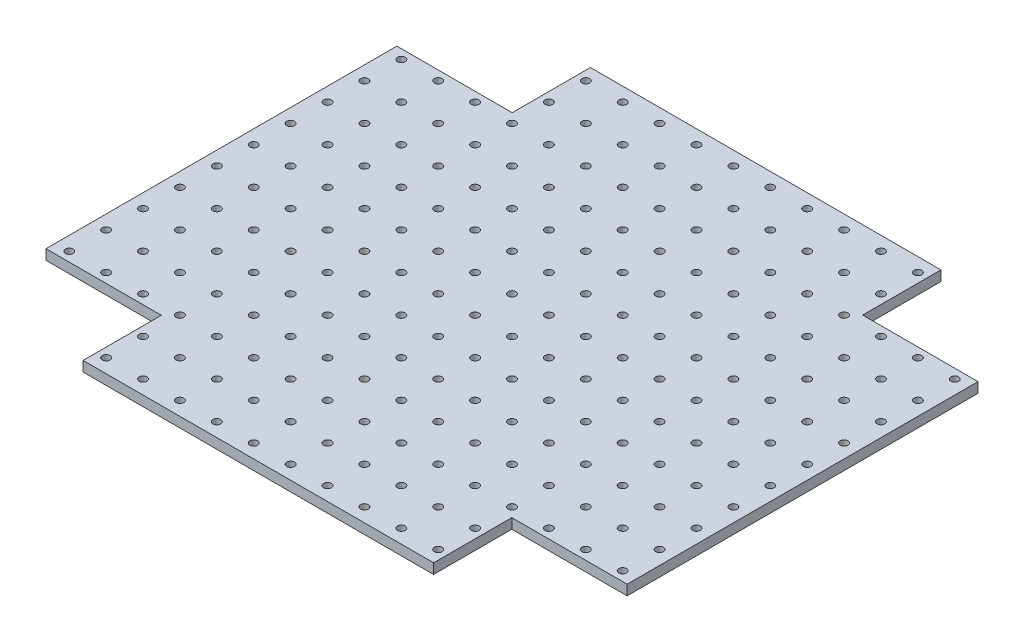
from build123d import *

# Parameters (mm, degrees)
BOSS_EXTRUDE1_DEPTH = 5.4864
SKETCH2_R           = 2.1
CUT_EXTRUDE1_DEPTH  = 210.1473179


with BuildPart() as part:
    # Sketch1 → Boss-Extrude1 (new body)
    with BuildSketch(Plane(origin=(0, 0, 0), x_dir=(1, 0, 0), z_dir=(0, 1, 0))):
        Polygon((95, -95.1), (157.5, -95.1), (157.5, 95.1), (95, 95.1), (95, 137.5), (-95, 137.5), (-95, 95.1), (-157.5, 95.1), (-157.5, -95.1), (-95, -95.1), (-95, -137.5), (95, -137.5), align=None)
    extrude(amount=BOSS_EXTRUDE1_DEPTH)

    # Sketch2 → Cut-Extrude1 (cut, through all)
    with BuildSketch(Plane(origin=(0, 5.4864, 0), x_dir=(1, 0, 0), z_dir=(0, 1, 0))):
        with Locations((90, -130)):
            Circle(SKETCH2_R)
        with Locations((70, -130)):
            Circle(SKETCH2_R)
        with Locations((50, -130)):
            Circle(SKETCH2_R)
        with Locations((30, -130)):
            Circle(SKETCH2_R)
        with Locations((10, -130)):
            Circle(SKETCH2_R)
        with Locations((-10, -130)):
            Circle(SKETCH2_R)
        with Locations((-30, -130)):
            Circle(SKETCH2_R)
        with Locations((-50, -130)):
            Circle(SKETCH2_R)
        with Locations((-70, -130)):
            Circle(SKETCH2_R)
        with Locations((-90, -130)):
            Circle(SKETCH2_R)
        with Locations((-110, -130)):
            Circle(SKETCH2_R)
        with Locations((90, -110)):
            Circle(SKETCH2_R)
        with Locations((70, -110)):
            Circle(SKETCH2_R)
        with Locations((50, -110)):
            Circle(SKETCH2_R)
        with Locations((30, -110)):
            Circle(SKETCH2_R)
        with Locations((10, -110)):
            Circle(SKETCH2_R)
        with Locations((-10, -110)):
            Circle(SKETCH2_R)
        with Locations((-30, -110)):
            Circle(SKETCH2_R)
        with Locations((-50, -110)):
            Circle(SKETCH2_R)
        with Locations((-70, -110)):
            Circle(SKETCH2_R)
        with Locations((-90, -110)):
            Circle(SKETCH2_R)
        with Locations((-110, -110)):
            Circle(SKETCH2_R)
        with Locations((150, -90)):
            Circle(SKETCH2_R)
        with Locations((130, -90)):
            Circle(SKETCH2_R)
        with Locations((110, -90)):
            Circle(SKETCH2_R)
        with Locations((90, -90)):
            Circle(SKETCH2_R)
        with Locations((70, -90)):
            Circle(SKETCH2_R)
        with Locations((50, -90)):
            Circle(SKETCH2_R)
        with Locations((30, -90)):
            Circle(SKETCH2_R)
        with Locations((10, -90)):
            Circle(SKETCH2_R)
        with Locations((-10, -90)):
            Circle(SKETCH2_R)
        with Locations((-30, -90)):
            Circle(SKETCH2_R)
        with Locations((-50, -90)):
            Circle(SKETCH2_R)
        with Locations((-70, -90)):
            Circle(SKETCH2_R)
        with Locations((-90, -90)):
            Circle(SKETCH2_R)
        with Locations((-110, -90)):
            Circle(SKETCH2_R)
        with Locations((-130, -90)):
            Circle(SKETCH2_R)
        with Locations((-150, -90)):
            Circle(SKETCH2_R)
        with Locations((150, -70)):
            Circle(SKETCH2_R)
        with Locations((130, -70)):
            Circle(SKETCH2_R)
        with Locations((110, -70)):
            Circle(SKETCH2_R)
        with Locations((90, -70)):
            Circle(SKETCH2_R)
        with Locations((70, -70)):
            Circle(SKETCH2_R)
        with Locations((50, -70)):
            Circle(SKETCH2_R)
        with Locations((30, -70)):
            Circle(SKETCH2_R)
        with Locations((10, -70)):
            Circle(SKETCH2_R)
        with Locations((-10, -70)):
            Circle(SKETCH2_R)
        with Locations((-30, -70)):
            Circle(SKETCH2_R)
        with Locations((-50, -70)):
            Circle(SKETCH2_R)
        with Locations((-70, -70)):
            Circle(SKETCH2_R)
        with Locations((-90, -70)):
            Circle(SKETCH2_R)
        with Locations((-110, -70)):
            Circle(SKETCH2_R)
        with Locations((-130, -70)):
            Circle(SKETCH2_R)
        with Locations((-150, -70)):
            Circle(SKETCH2_R)
        with Locations((150, -50)):
            Circle(SKETCH2_R)
        with Locations((130, -50)):
            Circle(SKETCH2_R)
        with Locations((110, -50)):
            Circle(SKETCH2_R)
        with Locations((90, -50)):
            Circle(SKETCH2_R)
        with Locations((70, -50)):
            Circle(SKETCH2_R)
        with Locations((50, -50)):
            Circle(SKETCH2_R)
        with Locations((30, -50)):
            Circle(SKETCH2_R)
        with Locations((10, -50)):
            Circle(SKETCH2_R)
        with Locations((-10, -50)):
            Circle(SKETCH2_R)
        with Locations((-30, -50)):
            Circle(SKETCH2_R)
        with Locations((-50, -50)):
            Circle(SKETCH2_R)
        with Locations((-70, -50)):
            Circle(SKETCH2_R)
        with Locations((-90, -50)):
            Circle(SKETCH2_R)
        with Locations((-110, -50)):
            Circle(SKETCH2_R)
        with Locations((-130, -50)):
            Circle(SKETCH2_R)
        with Locations((-150, -50)):
            Circle(SKETCH2_R)
        with Locations((150, -30)):
            Circle(SKETCH2_R)
        with Locations((130, -30)):
            Circle(SKETCH2_R)
        with Locations((110, -30)):
            Circle(SKETCH2_R)
        with Locations((90, -30)):
            Circle(SKETCH2_R)
        with Locations((70, -30)):
            Circle(SKETCH2_R)
        with Locations((50, -30)):
            Circle(SKETCH2_R)
        with Locations((30, -30)):
            Circle(SKETCH2_R)
        with Locations((10, -30)):
            Circle(SKETCH2_R)
        with Locations((-10, -30)):
            Circle(SKETCH2_R)
        with Locations((-30, -30)):
            Circle(SKETCH2_R)
        with Locations((-50, -30)):
            Circle(SKETCH2_R)
        with Locations((-70, -30)):
            Circle(SKETCH2_R)
        with Locations((-90, -30)):
            Circle(SKETCH2_R)
        with Locations((-110, -30)):
            Circle(SKETCH2_R)
        with Locations((-130, -30)):
            Circle(SKETCH2_R)
        with Locations((-150, -30)):
            Circle(SKETCH2_R)
        with Locations((150, -10)):
            Circle(SKETCH2_R)
        with Locations((130, -10)):
            Circle(SKETCH2_R)
        with Locations((110, -10)):
            Circle(SKETCH2_R)
        with Locations((90, -10)):
            Circle(SKETCH2_R)
        with Locations((70, -10)):
            Circle(SKETCH2_R)
        with Locations((50, -10)):
            Circle(SKETCH2_R)
        with Locations((30, -10)):
            Circle(SKETCH2_R)
        with Locations((10, -10)):
            Circle(SKETCH2_R)
        with Locations((-10, -10)):
            Circle(SKETCH2_R)
        with Locations((-30, -10)):
            Circle(SKETCH2_R)
        with Locations((-50, -10)):
            Circle(SKETCH2_R)
        with Locations((-70, -10)):
            Circle(SKETCH2_R)
        with Locations((-90, -10)):
            Circle(SKETCH2_R)
        with Locations((-110, -10)):
            Circle(SKETCH2_R)
        with Locations((-130, -10)):
            Circle(SKETCH2_R)
        with Locations((-150, -10)):
            Circle(SKETCH2_R)
        with Locations((150, 10)):
            Circle(SKETCH2_R)
        with Locations((130, 10)):
            Circle(SKETCH2_R)
        with Locations((110, 10)):
            Circle(SKETCH2_R)
        with Locations((90, 10)):
            Circle(SKETCH2_R)
        with Locations((70, 10)):
            Circle(SKETCH2_R)
        with Locations((50, 10)):
            Circle(SKETCH2_R)
        with Locations((30, 10)):
            Circle(SKETCH2_R)
        with Locations((10, 10)):
            Circle(SKETCH2_R)
        with Locations((-10, 10)):
            Circle(SKETCH2_R)
        with Locations((-30, 10)):
            Circle(SKETCH2_R)
        with Locations((-50, 10)):
            Circle(SKETCH2_R)
        with Locations((-70, 10)):
            Circle(SKETCH2_R)
        with Locations((-90, 10)):
            Circle(SKETCH2_R)
        with Locations((-110, 10)):
            Circle(SKETCH2_R)
        with Locations((-130, 10)):
            Circle(SKETCH2_R)
        with Locations((-150, 10)):
            Circle(SKETCH2_R)
        with Locations((150, 30)):
            Circle(SKETCH2_R)
        with Locations((130, 30)):
            Circle(SKETCH2_R)
        with Locations((110, 30)):
            Circle(SKETCH2_R)
        with Locations((90, 30)):
            Circle(SKETCH2_R)
        with Locations((70, 30)):
            Circle(SKETCH2_R)
        with Locations((50, 30)):
            Circle(SKETCH2_R)
        with Locations((30, 30)):
            Circle(SKETCH2_R)
        with Locations((10, 30)):
            Circle(SKETCH2_R)
        with Locations((-10, 30)):
            Circle(SKETCH2_R)
        with Locations((-30, 30)):
            Circle(SKETCH2_R)
        with Locations((-50, 30)):
            Circle(SKETCH2_R)
        with Locations((-70, 30)):
            Circle(SKETCH2_R)
        with Locations((-90, 30)):
            Circle(SKETCH2_R)
        with Locations((-110, 30)):
            Circle(SKETCH2_R)
        with Locations((-130, 30)):
            Circle(SKETCH2_R)
        with Locations((-150, 30)):
            Circle(SKETCH2_R)
        with Locations((150, 50)):
            Circle(SKETCH2_R)
        with Locations((130, 50)):
            Circle(SKETCH2_R)
        with Locations((110, 50)):
            Circle(SKETCH2_R)
        with Locations((90, 50)):
            Circle(SKETCH2_R)
        with Locations((70, 50)):
            Circle(SKETCH2_R)
        with Locations((50, 50)):
            Circle(SKETCH2_R)
        with Locations((30, 50)):
            Circle(SKETCH2_R)
        with Locations((10, 50)):
            Circle(SKETCH2_R)
        with Locations((-10, 50)):
            Circle(SKETCH2_R)
        with Locations((-30, 50)):
            Circle(SKETCH2_R)
        with Locations((-50, 50)):
            Circle(SKETCH2_R)
        with Locations((-70, 50)):
            Circle(SKETCH2_R)
        with Locations((-90, 50)):
            Circle(SKETCH2_R)
        with Locations((-110, 50)):
            Circle(SKETCH2_R)
        with Locations((-130, 50)):
            Circle(SKETCH2_R)
        with Locations((-150, 50)):
            Circle(SKETCH2_R)
        with Locations((150, 70)):
            Circle(SKETCH2_R)
        with Locations((130, 70)):
            Circle(SKETCH2_R)
        with Locations((110, 70)):
            Circle(SKETCH2_R)
        with Locations((90, 70)):
            Circle(SKETCH2_R)
        with Locations((70, 70)):
            Circle(SKETCH2_R)
        with Locations((50, 70)):
            Circle(SKETCH2_R)
        with Locations((30, 70)):
            Circle(SKETCH2_R)
        with Locations((10, 70)):
            Circle(SKETCH2_R)
        with Locations((-10, 70)):
            Circle(SKETCH2_R)
        with Locations((-30, 70)):
            Circle(SKETCH2_R)
        with Locations((-50, 70)):
            Circle(SKETCH2_R)
        with Locations((-70, 70)):
            Circle(SKETCH2_R)
        with Locations((-90, 70)):
            Circle(SKETCH2_R)
        with Locations((-110, 70)):
            Circle(SKETCH2_R)
        with Locations((-130, 70)):
            Circle(SKETCH2_R)
        with Locations((-150, 70)):
            Circle(SKETCH2_R)
        with Locations((150, 90)):
            Circle(SKETCH2_R)
        with Locations((130, 90)):
            Circle(SKETCH2_R)
        with Locations((110, 90)):
            Circle(SKETCH2_R)
        with Locations((90, 90)):
            Circle(SKETCH2_R)
        with Locations((70, 90)):
            Circle(SKETCH2_R)
        with Locations((50, 90)):
            Circle(SKETCH2_R)
        with Locations((30, 90)):
            Circle(SKETCH2_R)
        with Locations((10, 90)):
            Circle(SKETCH2_R)
        with Locations((-10, 90)):
            Circle(SKETCH2_R)
        with Locations((-30, 90)):
            Circle(SKETCH2_R)
        with Locations((-50, 90)):
            Circle(SKETCH2_R)
        with Locations((-70, 90)):
            Circle(SKETCH2_R)
        with Locations((-90, 90)):
            Circle(SKETCH2_R)
        with Locations((-110, 90)):
            Circle(SKETCH2_R)
        with Locations((-130, 90)):
            Circle(SKETCH2_R)
        with Locations((-150, 90)):
            Circle(SKETCH2_R)
        with Locations((150, 110)):
            Circle(SKETCH2_R)
        with Locations((130, 110)):
            Circle(SKETCH2_R)
        with Locations((110, 110)):
            Circle(SKETCH2_R)
        with Locations((90, 110)):
            Circle(SKETCH2_R)
        with Locations((70, 110)):
            Circle(SKETCH2_R)
        with Locations((50, 110)):
            Circle(SKETCH2_R)
        with Locations((30, 110)):
            Circle(SKETCH2_R)
        with Locations((10, 110)):
            Circle(SKETCH2_R)
        with Locations((-10, 110)):
            Circle(SKETCH2_R)
        with Locations((-30, 110)):
            Circle(SKETCH2_R)
        with Locations((-50, 110)):
            Circle(SKETCH2_R)
        with Locations((-70, 110)):
            Circle(SKETCH2_R)
        with Locations((-90, 110)):
            Circle(SKETCH2_R)
        with Locations((-110, 110)):
            Circle(SKETCH2_R)
        with Locations((-130, 110)):
            Circle(SKETCH2_R)
        with Locations((-150, 110)):
            Circle(SKETCH2_R)
        with Locations((110, 130)):
            Circle(SKETCH2_R)
        with Locations((90, 130)):
            Circle(SKETCH2_R)
        with Locations((70, 130)):
            Circle(SKETCH2_R)
        with Locations((50, 130)):
            Circle(SKETCH2_R)
        with Locations((30, 130)):
            Circle(SKETCH2_R)
        with Locations((10, 130)):
            Circle(SKETCH2_R)
        with Locations((-10, 130)):
            Circle(SKETCH2_R)
        with Locations((-30, 130)):
            Circle(SKETCH2_R)
        with Locations((-50, 130)):
            Circle(SKETCH2_R)
        with Locations((-70, 130)):
            Circle(SKETCH2_R)
        with Locations((-90, 130)):
            Circle(SKETCH2_R)
        with Locations((-110, 130)):
            Circle(SKETCH2_R)
        with Locations((90, 150)):
            Circle(SKETCH2_R)
        with Locations((70, 150)):
            Circle(SKETCH2_R)
        with Locations((50, 150)):
            Circle(SKETCH2_R)
        with Locations((30, 150)):
            Circle(SKETCH2_R)
        with Locations((10, 150)):
            Circle(SKETCH2_R)
        with Locations((-10, 150)):
            Circle(SKETCH2_R)
        with Locations((-30, 150)):
            Circle(SKETCH2_R)
        with Locations((-50, 150)):
            Circle(SKETCH2_R)
        with Locations((-70, 150)):
            Circle(SKETCH2_R)
        with Locations((-90, 150)):
            Circle(SKETCH2_R)
        with Locations((-110, 150)):
            Circle(SKETCH2_R)
    extrude(amount=-CUT_EXTRUDE1_DEPTH, mode=Mode.SUBTRACT)


solid = part.part
